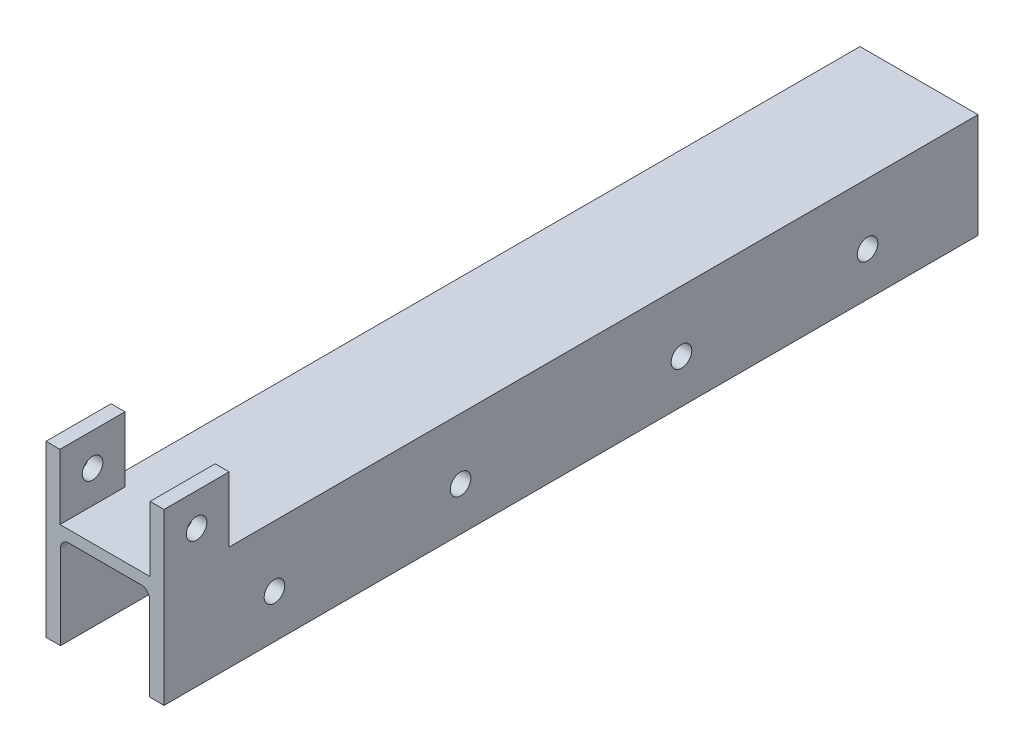
from build123d import *

# Parameters (mm, degrees)
BOSS_EXTRUDE2_DEPTH     = 177.8
SKETCH19_R              = 2.2479
CUT_EXTRUDE3_DEPTH      = 182.107922414
SKETCH21_W              = 3.048
SKETCH21_H              = 14.224
BOSS_EXTRUDE4_DEPTH     = 14.224
CUT_EXTRUDE4_DEPTH      = 184.043307294
CUT_EXTRUDE4_DEPTH_BACK = 184.043307294
SKETCH22_R              = 2.2479


with BuildPart() as part:
    # Sketch2 → Boss-Extrude2 (new body)
    with BuildSketch(Plane.XY):
        with BuildLine():
            Line((0, 0), (0, 22.86))
            Line((0, 22.86), (25.781, 22.86))
            Line((25.781, 22.86), (25.781, 0))
            Line((25.781, 0), (22.606, 0))
            Line((22.606, 0), (22.606, 18.542))
            ThreePointArc((22.606, 18.542), (22.085235857, 19.799235857), (20.828, 20.32))
            Line((20.828, 20.32), (4.953, 20.32))
            ThreePointArc((4.953, 20.32), (3.695764143, 19.799235857), (3.175, 18.542))
            Line((3.175, 18.542), (3.175, 0))
            Line((3.175, 0), (0, 0))
        make_face()
    extrude(amount=-BOSS_EXTRUDE2_DEPTH)

    # Sketch19 → Cut-Extrude3 (cut, through all)
    with BuildSketch(Plane(origin=(0, 0, 0), x_dir=(0, 0, -1), z_dir=(1, 0, 0))):
        with Locations((24.13, 9.525)):
            Circle(SKETCH19_R)
        with Locations((64.77, 9.525)):
            Circle(SKETCH19_R)
        with Locations((113.03, 9.525)):
            Circle(SKETCH19_R)
        with Locations((153.67, 9.525)):
            Circle(SKETCH19_R)
    extrude(amount=CUT_EXTRUDE3_DEPTH, mode=Mode.SUBTRACT)

    # Sketch21 → Boss-Extrude4 (add)
    with BuildSketch(Plane(origin=(0, 22.86, 0), x_dir=(1, 0, 0), z_dir=(0, 1, 0))):
        with Locations((1.524, 7.112)):
            Rectangle(SKETCH21_W, SKETCH21_H)
        with Locations((24.257, 7.112)):
            Rectangle(SKETCH21_W, SKETCH21_H)
    extrude(amount=BOSS_EXTRUDE4_DEPTH)

    # Sketch22 → Cut-Extrude4 (cut, two sides: drawn at the far end of the back side and taken through both)
    with BuildSketch(Plane.ZY.offset(-22.733).offset(-CUT_EXTRUDE4_DEPTH_BACK)):
        with Locations((-7.112, 29.972)):
            Circle(SKETCH22_R)
    extrude(amount=CUT_EXTRUDE4_DEPTH + CUT_EXTRUDE4_DEPTH_BACK, mode=Mode.SUBTRACT)


solid = part.part
